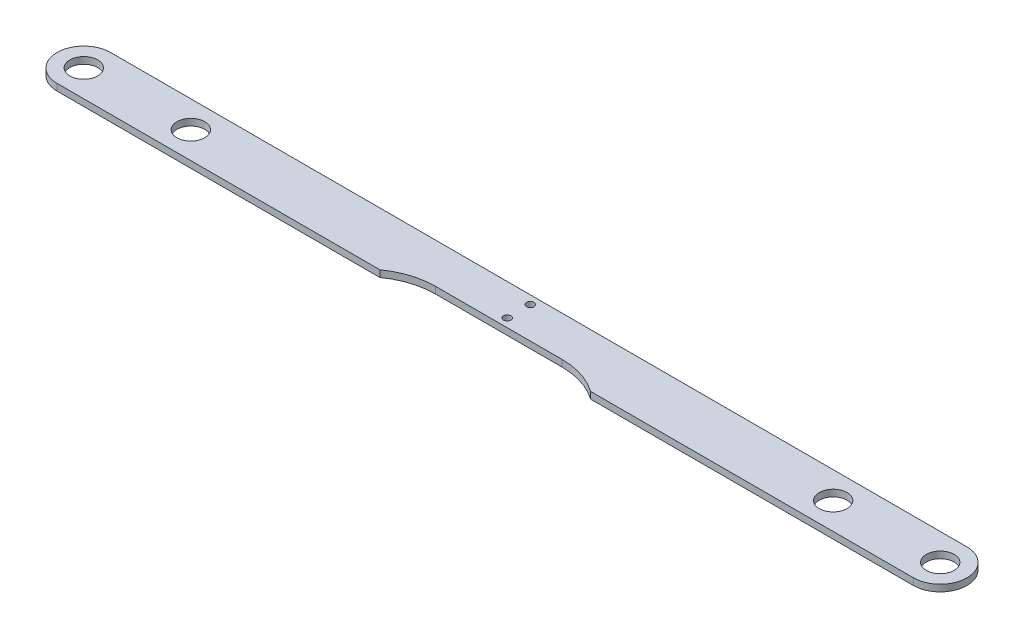
from build123d import *

# Parameters (mm, degrees)
SKETCH5_R           = 3.302
SKETCH5_R_2         = 0.889
BOSS_EXTRUDE1_DEPTH = 1.5875


with BuildPart() as part:
    # Sketch5 → Boss-Extrude1 (new body)
    with BuildSketch(Plane(origin=(0, 0, 0), x_dir=(1, 0, 0), z_dir=(0, 1, 0))):
        with BuildLine():
            Line((101.6, 4.75), (-101.6, 4.75))
            ThreePointArc((-101.6, 4.75), (-107.95, -1.6), (-101.6, -7.95))
            Line((-101.6, -7.95), (-25, -7.95))
            ThreePointArc((-25, -7.95), (-20.249761899, -5.569494064), (-15, -4.75))
            Line((-15, -4.75), (15, -4.75))
            ThreePointArc((15, -4.75), (20.249761899, -5.569494064), (25, -7.95))
            Line((25, -7.95), (101.6, -7.95))
            ThreePointArc((101.6, -7.95), (107.95, -1.6), (101.6, 4.75))
        make_face()
        with Locations((-101.6, -1.6)):
            Circle(SKETCH5_R, mode=Mode.SUBTRACT)
        with Locations((0, 2.75)):
            Circle(SKETCH5_R_2, mode=Mode.SUBTRACT)
        with Locations((101.6, -1.6)):
            Circle(SKETCH5_R, mode=Mode.SUBTRACT)
        with Locations((0, -2.75)):
            Circle(SKETCH5_R_2, mode=Mode.SUBTRACT)
        with Locations((-76.2, -1.6)):
            Circle(SKETCH5_R, mode=Mode.SUBTRACT)
        with Locations((76.2, -1.6)):
            Circle(SKETCH5_R, mode=Mode.SUBTRACT)
    extrude(amount=BOSS_EXTRUDE1_DEPTH)


solid = part.part
